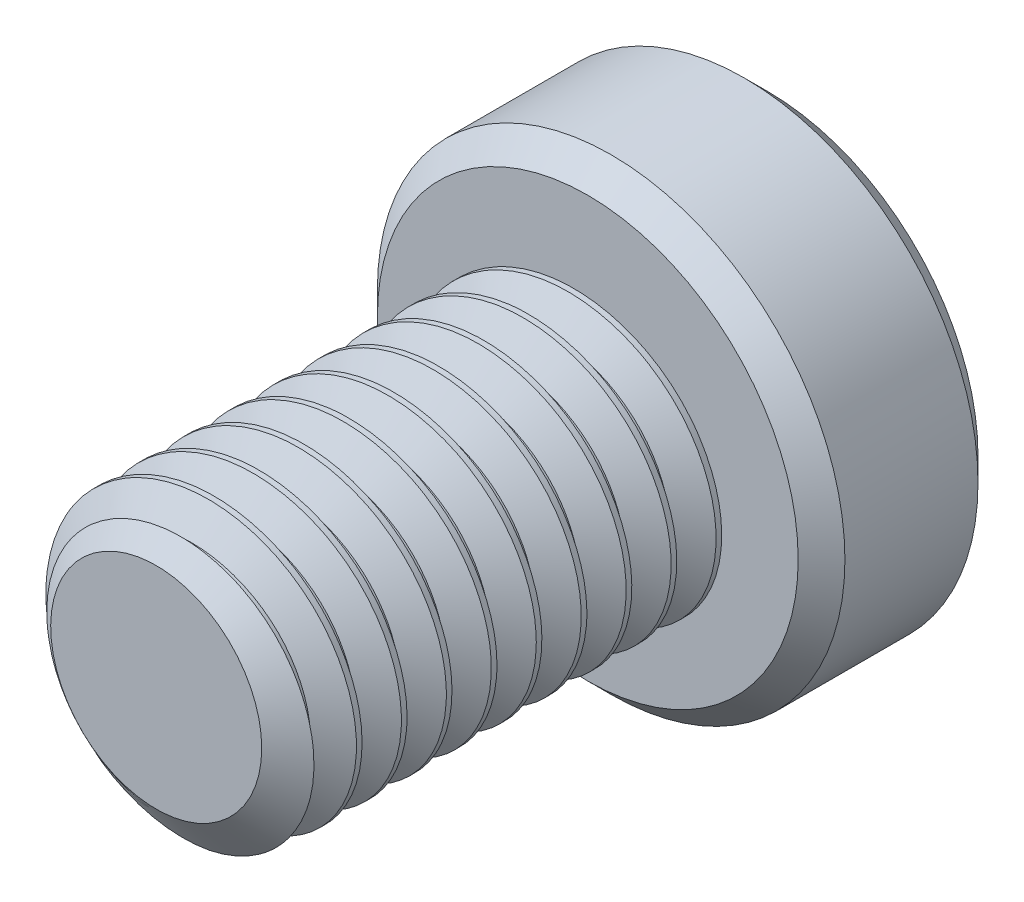
from build123d import *

# Parameters (mm, degrees)
SKETCH1_R          = 4
EXTRUDE1_DEPTH     = 12
CUT_SWEEP1_PITCH   = 1.25
SKETCH6_R          = 6.5
EXTRUDE2_DEPTH     = 5
CUT_EXTRUDE1_DEPTH = 3.75
CHAMFER1_SIZE      = 0.65


with BuildPart() as part:
    # Sketch1 → Extrude1 (new body)
    with BuildSketch(Plane.XY):
        Circle(SKETCH1_R)
    extrude(amount=-EXTRUDE1_DEPTH)

    # Cut-Sweep1: the profile of Sketch3 profile screwed along a right-hand helix of 10.6 turns, 6 arcs to a turn; built about Z, then put on its axis
    cut_sweep1_z = Axis((0, 0, 0), (0, 0, 1))
    cut_sweep1_corners = [(4.0003, 0, -1.093923205), (3.188101184, 0, -0.625), (3.188101184, 0, -0.46875), (4.0003, 0, 0.000173205)]
    with BuildLine(mode=Mode.PRIVATE) as cut_sweep1_profile:
        Line(cut_sweep1_corners[0], cut_sweep1_corners[1])
        Line(cut_sweep1_corners[1], cut_sweep1_corners[2])
        Line(cut_sweep1_corners[2], cut_sweep1_corners[3])
        Line(cut_sweep1_corners[3], cut_sweep1_corners[0])
    cut_sweep1_cap = Face(cut_sweep1_profile.wire())
    cut_sweep1_turn_angles = [0, 30, 60, 90, 120, 150, 180, 210, 240, 270, 300, 330, 360]
    cut_sweep1_turn_weights = [1, 0.8660254037844387, 1, 0.8660254037844387, 1, 0.8660254037844387, 1, 0.8660254037844387, 1, 0.8660254037844387, 1, 0.8660254037844387, 1]
    cut_sweep1_turn_rails = [Edge.make_bspline([Vector(p[0], p[1], 0).rotate(cut_sweep1_z, cut_sweep1_turn_angles[k]) / cut_sweep1_turn_weights[k] + Vector(0, 0, p[2] + CUT_SWEEP1_PITCH * cut_sweep1_turn_angles[k] / 360) for k in range(13)], [0, 0, 0, 1, 1, 2, 2, 3, 3, 4, 4, 5, 5, 6, 6, 6], 2, cut_sweep1_turn_weights) for p in cut_sweep1_corners]
    cut_sweep1_turn_sides = [Face.make_surface_from_curves(cut_sweep1_turn_rails[p[0]], cut_sweep1_turn_rails[p[1]]) for p in [(0, 1), (1, 2), (2, 3), (3, 0)]]
    cut_sweep1_last_angles = [3600, 3630, 3660, 3690, 3720, 3750, 3780, 3798, 3816]
    cut_sweep1_last_weights = [1, 0.8660254037844387, 1, 0.8660254037844387, 1, 0.8660254037844387, 1, 0.9510565162950726, 1]
    cut_sweep1_last_rails = [Edge.make_bspline([Vector(p[0], p[1], 0).rotate(cut_sweep1_z, cut_sweep1_last_angles[k]) / cut_sweep1_last_weights[k] + Vector(0, 0, p[2] + CUT_SWEEP1_PITCH * cut_sweep1_last_angles[k] / 360) for k in range(9)], [0, 0, 0, 1, 1, 2, 2, 3, 3, 4, 4, 4], 2, cut_sweep1_last_weights) for p in cut_sweep1_corners]
    cut_sweep1_last_sides = [Face.make_surface_from_curves(cut_sweep1_last_rails[p[0]], cut_sweep1_last_rails[p[1]]) for p in [(0, 1), (1, 2), (2, 3), (3, 0)]]
    cut_sweep1 = Plane(origin=(0, 0, 0), x_dir=(0, 1, 0), z_dir=(0, 0, -1)) * Solid(Shell([*[p.moved(Location((0, 0, CUT_SWEEP1_PITCH * i))) for i in range(10) for p in cut_sweep1_turn_sides], *cut_sweep1_last_sides, cut_sweep1_cap, cut_sweep1_cap.rotate(cut_sweep1_z, 3816).moved(Location((0, 0, CUT_SWEEP1_PITCH * 3816 / 360)))]))
    add(cut_sweep1, mode=Mode.SUBTRACT)

    # Sketch4 → Cut-Revolve1 (revolve, cut)
    with BuildSketch(Plane(origin=(0, 0, 0), x_dir=(0, 0, -1), z_dir=(1, 0, 0)), mode=Mode.PRIVATE) as cut_revolve1_sk:
        Polygon((0.746350386, 4), (0, 2.934101184), (0, 4), align=None)
    revolve(cut_revolve1_sk.sketch.rotate(Axis((0, 0, 0), (0, 0, -1)), 230.713364492), axis=Axis((0, 0, 0), (0, 0, -1)), mode=Mode.SUBTRACT)

    # Sketch6 → Extrude2 (add)
    with BuildSketch(Plane(origin=(0, 0, -12), x_dir=(-1, 0, 0), z_dir=(0, 0, -1))):
        Circle(SKETCH6_R)
    extrude(amount=EXTRUDE2_DEPTH)

    # Sketch7 → Cut-Extrude1 (cut)
    with BuildSketch(Plane(origin=(0, 0, -17), x_dir=(-1, 0, 0), z_dir=(0, 0, -1))):
        Polygon((0, 2.886751346), (-2.5, 1.443375673), (-2.5, -1.443375673), (0, -2.886751346), (2.5, -1.443375673), (2.5, 1.443375673), align=None)
    extrude(amount=-CUT_EXTRUDE1_DEPTH, mode=Mode.SUBTRACT)

    # Cut-Extrude2 cone 1 section (through the dimple's axis) → Cut-Extrude2 (revolve, cut)
    with BuildSketch(Plane(origin=(0, 0, -17), x_dir=(0, 1, 0), z_dir=(1, 0, 0))):
        Polygon((0, 0), (2.886751346, 0), (0, 2.886751346), align=None)
    revolve(axis=Axis((0, 0, -17), (0, 0, 1)), mode=Mode.SUBTRACT)

    # Chamfer1
    chamfer1_edges = [part.edges().sort_by_distance(p)[0] for p in [
        (6.5, 0, -12),
        (6.5, 0, -17),
    ]]
    chamfer(chamfer1_edges, length=CHAMFER1_SIZE)


solid = part.part
